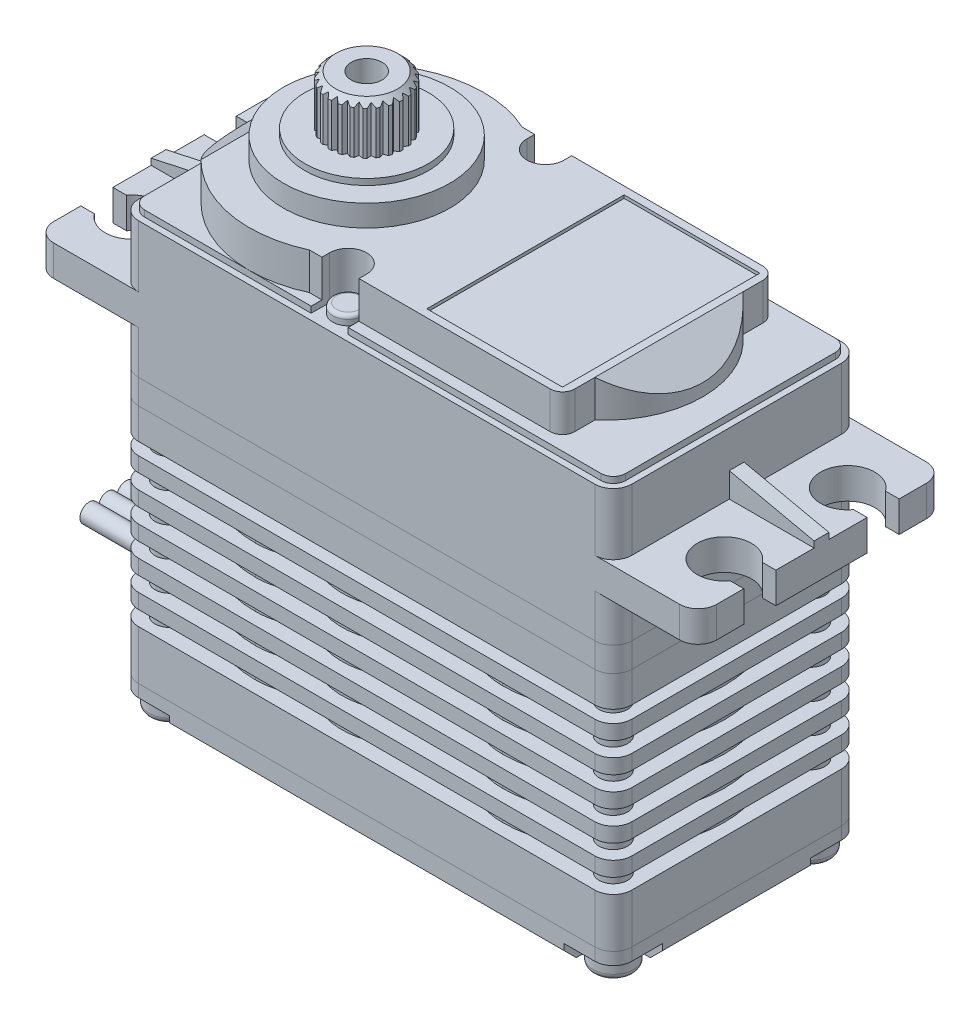
from build123d import *

# Parameters (mm, degrees)
BOSS_EXTRUDE2_DEPTH      = 7.5
BOSS_EXTRUDE2_DEPTH_BACK = 27.5
SKETCH3_W                = 40
SKETCH3_H                = 20
SKETCH4_W                = 53.75
SKETCH4_H                = 20
BOSS_EXTRUDE3_DEPTH      = 2.5
SKETCH5_R                = 2.2
CUT_EXTRUDE2_DEPTH       = 42.500188253
CUT_EXTRUDE3_DEPTH       = 42.500188253
FILLET1_R                = 1.5
FILLET2_R                = 1.5
BOSS_EXTRUDE4_DEPTH      = 0.5
BOSS_EXTRUDE5_DEPTH      = 0.6
BOSS_EXTRUDE6_DEPTH      = 3
SKETCH10_R               = 6.75
BOSS_EXTRUDE7_DEPTH      = 1.75
CUT_EXTRUDE4_DEPTH       = 40.730537688
CUT_EXTRUDE4_DEPTH_BACK  = 40.730537688
FILLET3_R                = 1
SKETCH12_R               = 5
BOSS_EXTRUDE8_DEPTH      = 0.5
CUT_EXTRUDE5_START       = -3.5
CUT_EXTRUDE5_DEPTH       = 3.5
CUT_EXTRUDE6_DEPTH       = 1.5
CHAMFER3_SIZE            = 1
SKETCH16_W               = 7
SKETCH16_H               = 4
BOSS_EXTRUDE9_DEPTH      = 1
SKETCH19_R               = 0.75
BOSS_EXTRUDE11_DEPTH     = 5
BOSS_EXTRUDE11_2_DEPTH   = 5
BOSS_EXTRUDE11_3_DEPTH   = 5
SKETCH20_W               = 11
SKETCH20_H               = 16
CUT_EXTRUDE7_DEPTH       = 0.25
SKETCH21_R               = 3
BOSS_EXTRUDE12_DEPTH     = 4
CHAMFER4_SIZE            = 0.5
CUT_EXTRUDE8_DEPTH       = 4
CIRPATTERN1_COUNT        = 25
SKETCH26_R               = 1.65
BOSS_EXTRUDE13_DEPTH     = 1.5
FILLET4_R                = 0.5
SKETCH27_R               = 1.15
CUT_EXTRUDE9_DEPTH       = 13
BOSS_EXTRUDE14_START     = 1.2
BOSS_EXTRUDE14_DEPTH     = 1.2
LPATTERN1_COUNT          = 5
LPATTERN1_PITCH          = 2.4
SKETCH29_R               = 1.25
BOSS_EXTRUDE15_DEPTH     = 0.75
FILLET5_R                = 0.3


with BuildPart() as part:
    # Sketch3 → Boss-Extrude2 (new, two sides: drawn at the far end of the back side and taken through both)
    with BuildSketch(Plane(origin=(0, 0, 0), x_dir=(1, 0, 0), z_dir=(0, 1, 0)).offset(-BOSS_EXTRUDE2_DEPTH_BACK)):
        Rectangle(SKETCH3_W, SKETCH3_H)
    extrude(amount=BOSS_EXTRUDE2_DEPTH + BOSS_EXTRUDE2_DEPTH_BACK)

    # Sketch4 → Boss-Extrude3 (add)
    with BuildSketch(Plane(origin=(0, 0, 0), x_dir=(1, 0, 0), z_dir=(0, 1, 0))):
        Rectangle(SKETCH4_W, SKETCH4_H)
    extrude(amount=BOSS_EXTRUDE3_DEPTH)

    # Sketch5 → Cut-Extrude2 (cut, through all)
    with BuildSketch(Plane(origin=(0, 2.5, 0), x_dir=(1, 0, 0), z_dir=(0, 1, 0))):
        with Locations(Location((-24, 5, 0), (0, 0, 270))):
            Circle(SKETCH5_R)
        with Locations(Location((-24, -5, 0), (0, 0, 270))):
            Circle(SKETCH5_R)
        with Locations(Location((24, -5, 0), (0, 0, 270))):
            Circle(SKETCH5_R)
        with Locations(Location((24, 5, 0), (0, 0, 270))):
            Circle(SKETCH5_R)
    extrude(amount=-CUT_EXTRUDE2_DEPTH, mode=Mode.SUBTRACT)

    # Sketch6 → Cut-Extrude3 (cut, through all)
    with BuildSketch(Plane(origin=(0, 2.5, 0), x_dir=(1, 0, 0), z_dir=(0, 1, 0))):
        with BuildLine():
            Line((-24, 3.7), (-26.875, 3.7))
            ThreePointArc((-26.875, 3.7), (-28.175, 5), (-26.875, 6.3))
            Line((-26.875, 6.3), (-24, 6.3))
            ThreePointArc((-24, 6.3), (-22.7, 5), (-24, 3.7))
        make_face()
        with BuildLine():
            Line((-24, -6.3), (-26.875, -6.3))
            ThreePointArc((-26.875, -6.3), (-28.175, -5), (-26.875, -3.7))
            Line((-26.875, -3.7), (-24, -3.7))
            ThreePointArc((-24, -3.7), (-22.7, -5), (-24, -6.3))
        make_face()
        with BuildLine():
            Line((24, -3.7), (26.875, -3.7))
            ThreePointArc((26.875, -3.7), (28.175, -5), (26.875, -6.3))
            Line((26.875, -6.3), (24, -6.3))
            ThreePointArc((24, -6.3), (22.7, -5), (24, -3.7))
        make_face()
        with BuildLine():
            Line((24, 6.3), (26.875, 6.3))
            ThreePointArc((26.875, 6.3), (28.175, 5), (26.875, 3.7))
            Line((26.875, 3.7), (24, 3.7))
            ThreePointArc((24, 3.7), (22.7, 5), (24, 6.3))
        make_face()
    extrude(amount=-CUT_EXTRUDE3_DEPTH, mode=Mode.SUBTRACT)

    # Fillet1
    fillet1_edges = [part.edges().sort_by_distance(p)[0] for p in [
        (26.875, 1.25, -10),
        (-26.875, 1.25, 10),
        (26.875, 1.25, 10),
        (-26.875, 1.25, -10),
    ]]
    fillet(fillet1_edges, radius=FILLET1_R)

    # Fillet2
    fillet2_edges = [part.edges().sort_by_distance(p)[0] for p in [
        (-20, -13.75, 10),
        (20, -13.75, 10),
        (-20, -13.75, -10),
        (20, -13.75, -10),
        (20, 5, 10),
        (-20, 5, 10),
        (-20, 5, -10),
        (20, 5, -10),
    ]]
    fillet(fillet2_edges, radius=FILLET2_R)

    # Sketch7 → Boss-Extrude4 (add)
    with BuildSketch(Plane(origin=(0, 7.5, 0), x_dir=(1, 0, 0), z_dir=(0, 1, 0))):
        with BuildLine():
            Line((19.5, -8.5), (19.5, 8.5))
            ThreePointArc((19.5, 8.5), (19.207106781, 9.207106781), (18.5, 9.5))
            Line((18.5, 9.5), (-18.5, 9.5))
            ThreePointArc((-18.5, 9.5), (-19.207106781, 9.207106781), (-19.5, 8.5))
            Line((-19.5, 8.5), (-19.5, -8.5))
            ThreePointArc((-19.5, -8.5), (-19.207106781, -9.207106781), (-18.5, -9.5))
            Line((-18.5, -9.5), (18.5, -9.5))
            ThreePointArc((18.5, -9.5), (19.207106781, -9.207106781), (19.5, -8.5))
        make_face()
    extrude(amount=BOSS_EXTRUDE4_DEPTH)

    # Sketch8 → Boss-Extrude5 (add, symmetric)
    with BuildSketch(Plane.XY):
        Polygon((20, 4.5), (26.875, 3), (26.875, 2.5), (20, 2.5), align=None)
        Polygon((-26.875, 2.5), (-26.875, 3), (-20, 4.5), (-20, 2.5), align=None)
    extrude(amount=BOSS_EXTRUDE5_DEPTH, both=True)

    # Sketch9 → Boss-Extrude6 (add)
    with BuildSketch(Plane(origin=(0, 8, 0), x_dir=(1, 0, 0), z_dir=(0, 1, 0))):
        with BuildLine():
            Line((-6.017616919, 8.625), (14.5, 8.625))
            Line((14.5, 8.625), (14.5, 6))
            ThreePointArc((14.5, 6), (17.25, 0), (14.5, -6))
            Line((14.5, -6), (14.5, -8.625))
            Line((14.5, -8.625), (-6.017616919, -8.625))
            ThreePointArc((-6.017616919, -8.625), (-19.5, 0), (-6.017616919, 8.625))
        make_face()
    extrude(amount=BOSS_EXTRUDE6_DEPTH)

    # Sketch10 → Boss-Extrude7 (add)
    with BuildSketch(Plane(origin=(0, 11, 0), x_dir=(1, 0, 0), z_dir=(0, 1, 0))):
        with Locations(Location((-10, 0, 0), (0, 0, 270))):
            Circle(SKETCH10_R)
    extrude(amount=BOSS_EXTRUDE7_DEPTH)

    # Sketch11 → Cut-Extrude4 (cut, two sides: drawn at the far end of the back side and taken through both)
    with BuildSketch(Plane.XY.offset(-CUT_EXTRUDE4_DEPTH_BACK)):
        Polygon((14.5, 11), (17.25, 9), (17.25, 11), align=None)
        Polygon((-16.75, 11), (-19.5, 9), (-19.5, 11), align=None)
    extrude(amount=CUT_EXTRUDE4_DEPTH + CUT_EXTRUDE4_DEPTH_BACK, mode=Mode.SUBTRACT)

    # Fillet3
    fillet3_edges = [part.edges().sort_by_distance(p)[0] for p in [
        (14.5, 9.5, 8.625),
        (14.5, 9.5, -8.625),
    ]]
    fillet(fillet3_edges, radius=FILLET3_R)

    # Sketch12 → Boss-Extrude8 (add)
    with BuildSketch(Plane(origin=(0, 12.75, 0), x_dir=(1, 0, 0), z_dir=(0, 1, 0))):
        with Locations(Location((-10, 0, 0), (0, 0, 270))):
            Circle(SKETCH12_R)
    extrude(amount=BOSS_EXTRUDE8_DEPTH)


with BuildPart() as body_2:
    # Split1: the piece on the far side of the plane
    add(part.part)
    split(bisect_by=Plane.ZX.offset(-3.5), keep=Keep.BOTTOM)


with BuildPart() as part_1:
    add(part.part)

    # Split1
    split(bisect_by=Plane.ZX.offset(-3.5), keep=Keep.TOP)

    # Sketch13 → Cut-Extrude5 (cut)
    with BuildSketch(Plane(origin=(0, 11, 0), x_dir=(1, 0, 0), z_dir=(0, 1, 0)).offset(CUT_EXTRUDE5_START)):
        with BuildLine():
            Line((-2, -8), (-2, -9.5))
            ThreePointArc((-2, -9.5), (-3.5, -11), (-5, -9.5))
            Line((-5, -9.5), (-5, -8))
            ThreePointArc((-5, -8), (-3.5, -6.5), (-2, -8))
        make_face()
        with BuildLine():
            Line((-5, 8), (-5, 9.5))
            ThreePointArc((-5, 9.5), (-3.5, 11), (-2, 9.5))
            Line((-2, 9.5), (-2, 8))
            ThreePointArc((-2, 8), (-3.5, 6.5), (-5, 8))
        make_face()
    extrude(amount=CUT_EXTRUDE5_DEPTH, mode=Mode.SUBTRACT)

    # Sketch20 → Cut-Extrude7 (cut)
    with BuildSketch(Plane(origin=(0, 11, 0), x_dir=(1, 0, 0), z_dir=(0, 1, 0))):
        with Locations((8.375, 0)):
            Rectangle(SKETCH20_W, SKETCH20_H)
    extrude(amount=-CUT_EXTRUDE7_DEPTH, mode=Mode.SUBTRACT)

    # Sketch29 → Boss-Extrude15 (add)
    with BuildSketch(Plane(origin=(0, 7.5, 0), x_dir=(1, 0, 0), z_dir=(0, 1, 0))):
        with Locations(Location((-3.5, -8, 0), (0, 0, 90))):
            Circle(SKETCH29_R)
        with Locations(Location((-3.5, 8, 0), (0, 0, 90))):
            Circle(SKETCH29_R)
    extrude(amount=BOSS_EXTRUDE15_DEPTH)

    # Fillet5
    fillet5_edges = [part_1.edges().sort_by_distance(p)[0] for p in [
        (-3.5, 8.25, 9.25),
        (-3.5, 8.25, -6.75),
    ]]
    fillet(fillet5_edges, radius=FILLET5_R)


with BuildPart() as body_3:
    # Split2: the piece on the far side of the plane
    add(body_2.part)
    split(bisect_by=Plane.ZX.offset(-5.5), keep=Keep.BOTTOM)


with BuildPart() as body_2_1:
    add(body_2.part)

    # Split2
    split(bisect_by=Plane.ZX.offset(-5.5), keep=Keep.TOP)


with BuildPart() as body_4:
    # Split3: the piece on the far side of the plane
    add(body_3.part)
    split(bisect_by=Plane(origin=(0, -25, 0), x_dir=(0, 0, -1), z_dir=(0, -1, 0)), keep=Keep.BOTTOM)

    # Sketch27 → Cut-Extrude9 (cut)
    with BuildSketch(Plane(origin=(0, -21, 0), x_dir=(-1, 0, 0), z_dir=(0, -1, 0))):
        with BuildLine():
            Line((18.5, 10), (-18.5, 10))
            ThreePointArc((-18.5, 10), (-19.560660172, 9.560660172), (-20, 8.5))
            Line((-20, 8.5), (-20, -8.5))
            ThreePointArc((-20, -8.5), (-19.560660172, -9.560660172), (-18.5, -10))
            Line((-18.5, -10), (18.5, -10))
            ThreePointArc((18.5, -10), (19.560660172, -9.560660172), (20, -8.5))
            Line((20, -8.5), (20, 8.5))
            ThreePointArc((20, 8.5), (19.560660172, 9.560660172), (18.5, 10))
        make_face()
        with Locations(Location((-18, 8, 0), (0, 0, 90))):
            Circle(SKETCH27_R, mode=Mode.SUBTRACT)
        with Locations(Location((-18, -8, 0), (0, 0, 90))):
            Circle(SKETCH27_R, mode=Mode.SUBTRACT)
        with Locations(Location((18, -8, 0), (0, 0, 90))):
            Circle(SKETCH27_R, mode=Mode.SUBTRACT)
        with Locations(Location((18, 8, 0), (0, 0, 90))):
            Circle(SKETCH27_R, mode=Mode.SUBTRACT)
        with BuildLine():
            ThreePointArc((9.999997958, 9), (19, 0), (9.999997958, -9))
            ThreePointArc((9.999997958, -9), (9.220994585, -8.944637789), (8.457649975, -8.779664345))
            ThreePointArc((8.457649975, -8.779664345), (6.5, -8.5), (4.542350025, -8.779664345))
            ThreePointArc((4.542350025, -8.779664345), (2.532890638, -8.980158848), (0.586212602, -8.442972011))
            ThreePointArc((0.586212602, -8.442972011), (-3.5, -7.5), (-7.586212571, -8.442972145))
            ThreePointArc((-7.586212571, -8.442972145), (-8.761386886, -8.858936806), (-10, -9))
            ThreePointArc((-10, -9), (-19, 0), (-10, 9))
            ThreePointArc((-10, 9), (-8.761386886, 8.858936806), (-7.586212571, 8.442972145))
            ThreePointArc((-7.586212571, 8.442972145), (-3.5, 7.5), (0.586212602, 8.442972011))
            ThreePointArc((0.586212602, 8.442972011), (2.532890638, 8.980158848), (4.542350025, 8.779664345))
            ThreePointArc((4.542350025, 8.779664345), (6.5, 8.5), (8.457649975, 8.779664345))
            ThreePointArc((8.457649975, 8.779664345), (9.220994585, 8.944637789), (9.999997958, 9))
        make_face(mode=Mode.SUBTRACT)
    extrude(amount=-CUT_EXTRUDE9_DEPTH, mode=Mode.SUBTRACT)

    # Sketch28 → Boss-Extrude14 (add)
    with BuildSketch(Plane(origin=(0, -21, 0), x_dir=(1, 0, 0), z_dir=(0, 1, 0)).offset(BOSS_EXTRUDE14_START)):
        with BuildLine():
            Line((18.5, 10), (-18.5, 10))
            ThreePointArc((-18.5, 10), (-19.560660172, 9.560660172), (-20, 8.5))
            Line((-20, 8.5), (-20, -8.5))
            ThreePointArc((-20, -8.5), (-19.560660172, -9.560660172), (-18.5, -10))
            Line((-18.5, -10), (18.5, -10))
            ThreePointArc((18.5, -10), (19.560660172, -9.560660172), (20, -8.5))
            Line((20, -8.5), (20, 8.5))
            ThreePointArc((20, 8.5), (19.560660172, 9.560660172), (18.5, 10))
        make_face()
    boss_extrude14 = extrude(amount=BOSS_EXTRUDE14_DEPTH)

    # LPattern1: Boss-Extrude14 ×5
    with Locations(*[(0, i * LPATTERN1_PITCH, 0) for i in range(1, LPATTERN1_COUNT)]):
        add(boss_extrude14)


with BuildPart() as body_3_1:
    add(body_3.part)

    # Split3
    split(bisect_by=Plane(origin=(0, -25, 0), x_dir=(0, 0, -1), z_dir=(0, -1, 0)), keep=Keep.TOP)

    # Sketch15 → Cut-Extrude6 (cut)
    with BuildSketch(Plane.XZ.offset(27.5)):
        with BuildLine():
            Line((-20, 6), (-18, 6))
            ThreePointArc((-18, 6), (-16.585786438, 6.585786438), (-16, 8))
            Line((-16, 8), (-16, 10))
            Line((-16, 10), (-20, 10))
            Line((-20, 10), (-20, 6))
        make_face()
        with BuildLine():
            Line((-20, -6), (-18, -6))
            ThreePointArc((-18, -6), (-16.585786438, -6.585786438), (-16, -8))
            Line((-16, -8), (-16, -10))
            Line((-16, -10), (-20, -10))
            Line((-20, -10), (-20, -6))
        make_face()
        with BuildLine():
            Line((16, -10), (20, -10))
            Line((20, -10), (20, -6))
            Line((20, -6), (18, -6))
            ThreePointArc((18, -6), (16.585786438, -6.585786438), (16, -8))
            Line((16, -8), (16, -10))
        make_face()
        with BuildLine():
            Line((20, 6), (18, 6))
            ThreePointArc((18, 6), (16.585786438, 6.585786438), (16, 8))
            Line((16, 8), (16, 10))
            Line((16, 10), (20, 10))
            Line((20, 10), (20, 6))
        make_face()
    extrude(amount=-CUT_EXTRUDE6_DEPTH, mode=Mode.SUBTRACT)

    # Chamfer3
    chamfer3_edges = [body_3_1.edges().sort_by_distance(p)[0] for p in [
        (-20, -27.5, 0),
        (0, -27.5, -10),
        (20, -27.5, 0),
        (0, -27.5, 10),
    ]]
    chamfer(chamfer3_edges, length=CHAMFER3_SIZE)

    # Sketch26 → Boss-Extrude13 (add)
    with BuildSketch(Plane.XZ.offset(26)):
        with Locations(Location((18, -8, 0), (0, 0, 90))):
            Circle(SKETCH26_R)
        with Locations(Location((-18, -8, 0), (0, 0, 90))):
            Circle(SKETCH26_R)
        with Locations(Location((-18, 8, 0), (0, 0, 270))):
            Circle(SKETCH26_R)
        with Locations(Location((18, 8, 0), (0, 0, 90))):
            Circle(SKETCH26_R)
    extrude(amount=BOSS_EXTRUDE13_DEPTH)

    # Fillet4
    fillet4_edges = [body_3_1.edges().sort_by_distance(p)[0] for p in [
        (18, -27.5, -9.65),
        (-18, -27.5, -9.65),
        (-18, -27.5, 9.65),
        (18, -27.5, 6.35),
    ]]
    fillet(fillet4_edges, radius=FILLET4_R)


with BuildPart() as body_5:
    # Sketch16 → Boss-Extrude9 (new body)
    with BuildSketch(Plane.ZY.offset(20)):
        with Locations((0, -23.5)):
            Rectangle(SKETCH16_W, SKETCH16_H)
    extrude(amount=BOSS_EXTRUDE9_DEPTH)

    # Sketch17 → Loft1 section 0
    with BuildSketch(Plane.ZY.offset(21)):
        with BuildLine():
            Line((-3.25, -21.75), (-3.25, -25.25))
            Line((-3.25, -25.25), (3.25, -25.25))
            Line((3.25, -25.25), (3.25, -21.75))
            Line((3.25, -21.75), (-3.25, -21.75))
        make_face()
    # Sketch18 → Loft1 section 1
    with BuildSketch(Plane.ZY.offset(26)):
        with BuildLine():
            Line((-2.5, -24.75), (2.5, -24.75))
            Line((2.5, -24.75), (2.5, -22.25))
            Line((2.5, -22.25), (-2.5, -22.25))
            Line((-2.5, -22.25), (-2.5, -24.75))
        make_face()
    loft()


with BuildPart() as body_6:
    # Sketch19 → Boss-Extrude11 (new body)
    with BuildSketch(Plane.ZY.offset(26)):
        with Locations((-1.5, -23.5)):
            Circle(SKETCH19_R)
    extrude(amount=BOSS_EXTRUDE11_DEPTH)


with BuildPart() as body_7:
    # Sketch19 → Boss-Extrude11 2 (new body)
    with BuildSketch(Plane.ZY.offset(26)):
        with Locations((0, -23.5)):
            Circle(SKETCH19_R)
    extrude(amount=BOSS_EXTRUDE11_2_DEPTH)


with BuildPart() as body_8:
    # Sketch19 → Boss-Extrude11 3 (new body)
    with BuildSketch(Plane.ZY.offset(26)):
        with Locations((1.5, -23.5)):
            Circle(SKETCH19_R)
    extrude(amount=BOSS_EXTRUDE11_3_DEPTH)


with BuildPart() as body_9:
    # Sketch21 → Boss-Extrude12 (new body)
    with BuildSketch(Plane(origin=(0, 13.25, 0), x_dir=(1, 0, 0), z_dir=(0, 1, 0))):
        with Locations(Location((-10, 0, 0), (0, 0, 270))):
            Circle(SKETCH21_R)
    extrude(amount=BOSS_EXTRUDE12_DEPTH)

    # Chamfer4
    chamfer4_edges = [body_9.edges().sort_by_distance(p)[0] for p in [
        (-10, 17.25, -3),
    ]]
    chamfer(chamfer4_edges, length=CHAMFER4_SIZE)

    # Sketch22 → Cut-Extrude8 (cut)
    with BuildSketch(Plane(origin=(0, 17.25, 0), x_dir=(1, 0, 0), z_dir=(0, 1, 0))):
        with BuildLine():
            Line((-10.25, 2.989565186), (-10, 2.75))
            Line((-10, 2.75), (-9.75, 2.989565186))
            ThreePointArc((-9.75, 2.989565186), (-10, 3), (-10.25, 2.989565186))
        make_face()
    cut_extrude8 = extrude(amount=-CUT_EXTRUDE8_DEPTH, mode=Mode.SUBTRACT)

    # CirPattern1: Cut-Extrude8 ×25 about axis
    cirpattern1_axis = Axis((-10, 0, 0), (0, 1, 0))
    for i in range(1, CIRPATTERN1_COUNT):
        add(cut_extrude8.rotate(cirpattern1_axis, i * 360 / CIRPATTERN1_COUNT), mode=Mode.SUBTRACT)

    # Sketch25 → M3x0.5 Tapped Hole1 (revolve, cut)
    with BuildSketch(Plane(origin=(-10, 17.25, 0), x_dir=(0, 0, 1), z_dir=(1, 0, 0))):
        Polygon((0, 0), (0, 9.251075774), (1.25, 8.5), (1.25, 0), align=None)
    revolve(axis=Axis((-10, 23.6, 0), (0, -1, 0)), mode=Mode.SUBTRACT)


solid = Compound([part_1.part, body_2_1.part, body_4.part, body_3_1.part, body_5.part, body_6.part, body_7.part, body_8.part, body_9.part])
